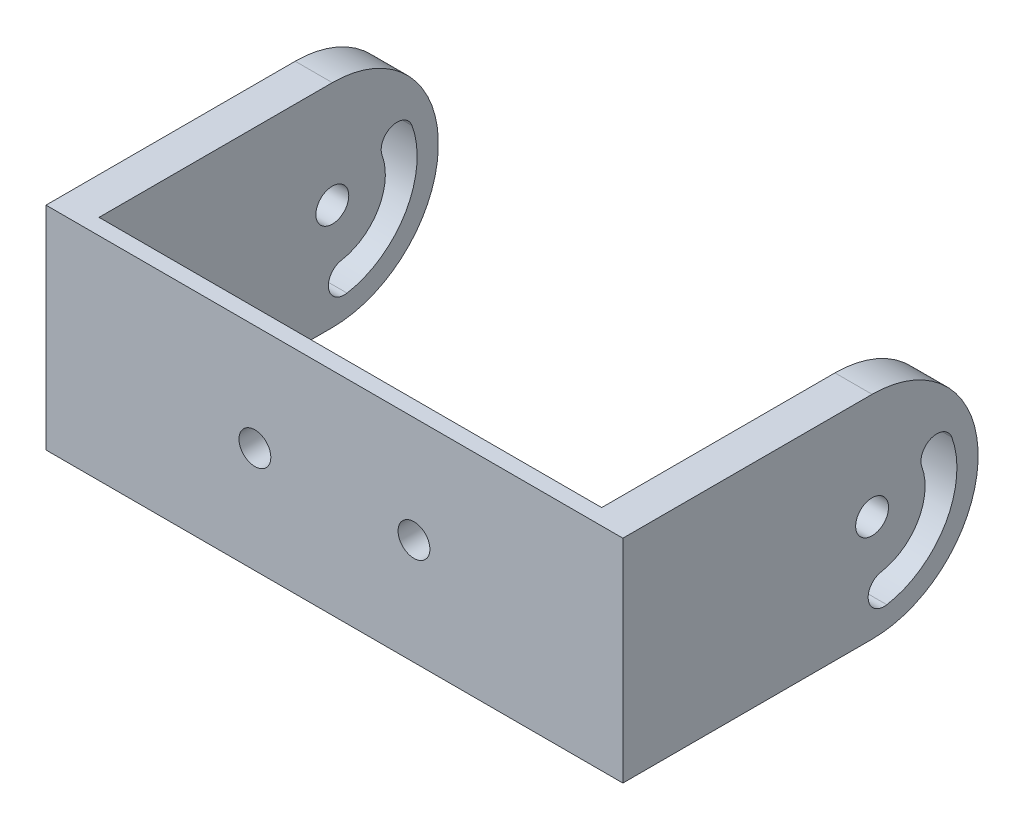
from build123d import *

# Parameters (mm, degrees)
SKETCH_1_W          = 54.4
SKETCH_1_H          = 20
EXTRUDE_1_DEPTH     = 3.5
SKETCH_2_R          = 1.55
EXTRUDE_2_DEPTH     = 3.5
SKETCH_3_R          = 1.5
CUT_EXTRUDE_1_DEPTH = 10
CHAMFER_1_SIZE      = 2


with BuildPart() as part:
    # 草图1 → 凸台-拉伸1 (new body)
    with BuildSketch(Plane.XY):
        with Locations((0.3, -5)):
            Rectangle(SKETCH_1_W, SKETCH_1_H)
    extrude(amount=EXTRUDE_1_DEPTH)

    # 草图2 → 凸台-拉伸2 (add)
    with BuildSketch(Plane(origin=(27.5, 0, 0), x_dir=(0, 0, -1), z_dir=(1, 0, 0))):
        with BuildLine():
            Line((0, 5), (0, -15))
            Line((0, -15), (20, -15))
            ThreePointArc((20, -15), (30, -5), (20, 5))
            Line((20, 5), (0, 5))
        make_face()
        with Locations((20, -5)):
            Circle(SKETCH_2_R, mode=Mode.SUBTRACT)
        with BuildLine():
            ThreePointArc((21.389185421, -12.878462024), (26.92820323, -9), (27.517540966, -2.263838853))
            ThreePointArc((27.517540966, -2.263838853), (25.59497182, -1.367330137), (24.698463104, -3.289899283))
            ThreePointArc((24.698463104, -3.289899283), (24.330127019, -7.5), (20.868240888, -9.924038765))
            ThreePointArc((20.868240888, -9.924038765), (19.651501525, -11.661722661), (21.389185421, -12.878462024))
        make_face(mode=Mode.SUBTRACT)
    extrude_2 = extrude(amount=-EXTRUDE_2_DEPTH)

    # 镜向1: 凸台-拉伸2 across plane
    add(extrude_2.mirror(Plane.ZY.offset(-0.3)))

    # 草图3 → 切除-拉伸1 (cut)
    with BuildSketch(Plane.XY.offset(3.5)):
        with Locations((7.8, -5)):
            Circle(SKETCH_3_R)
        with Locations((-7.2, -5)):
            Circle(SKETCH_3_R)
    extrude(amount=-CUT_EXTRUDE_1_DEPTH, mode=Mode.SUBTRACT)

    # 倒角1
    chamfer_1_edges = [part.edges().sort_by_distance(p)[0] for p in [
        (0.3, 5, 0),
    ]]
    chamfer(chamfer_1_edges, length=CHAMFER_1_SIZE)


solid = part.part
